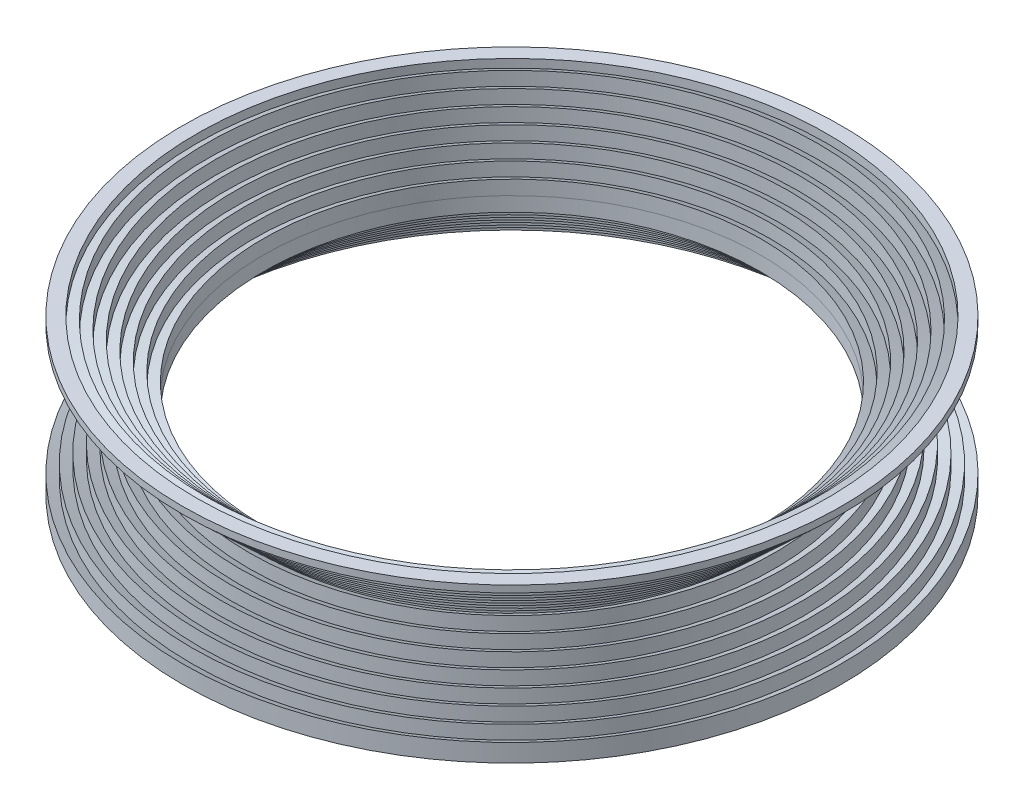
from build123d import *

# Parameters (mm, degrees)
SKETCH_1_R      = 35.893803705
EXTRUDE_1_DEPTH = 1.2


# Read off the part's stored shape, not the designer's step: 쉘1
with BuildPart() as part:
    # 스케치1 → 보스-돌출1 (new body)
    with BuildSketch(Plane(origin=(0, 0, 0), x_dir=(1, 0, 0), z_dir=(0, 1, 0))):
        with Locations(Location((0, 0, 0), (0, 0, 270))):
            Circle(SKETCH_1_R)
    extrude(amount=EXTRUDE_1_DEPTH)

    # 스케치4 → 회전1 (revolve)
    with BuildSketch(Plane(origin=(0, 0, 0), x_dir=(0, 0, -1), z_dir=(1, 0, 0))):
        Polygon((-27.588745887, 9), (0, 9), (0, 1.2), (-35.893803705, 1.2), (-35.893803705, 1.95), (-34.855087797, 1.425548185), (-34.855087797, 2.925548185), (-33.816371888, 2.401096371), (-33.816371888, 3.901096371), (-32.77765598, 3.376644556), (-32.77765598, 4.876644556), (-31.738940072, 4.352192742), (-31.738940072, 5.852192742), (-30.700224164, 5.327740927), (-30.700224164, 6.827740927), (-29.661508256, 6.303289112), (-29.661508256, 7.803289112), (-28.622792347, 7.278837298), (-28.622792347, 8.778837298), (-27.584076439, 8.254385483), align=None)
    revolve_1 = revolve(axis=Axis((0, 9, 0), (0, -1, 0)))

    # 대칭 복사1: 회전1 across plane
    add(revolve_1.mirror(Plane(origin=(0, 9, 27.588745887), x_dir=(0, 0, 1), z_dir=(0, 1, 0))))

    # 쉘1 outline → 쉘1 (revolve, cut)
    with BuildSketch(Plane.XY):
        Polygon((35.393803705, 0), (35.393803705, 1.137430146), (34.355087797, 0.612978331), (34.355087797, 2.112978331), (33.316371888, 1.588526517), (33.316371888, 3.088526517), (32.27765598, 2.564074702), (32.27765598, 4.064074702), (31.238940072, 3.539622887), (31.238940072, 5.039622887), (30.200224164, 4.515171073), (30.200224164, 6.015171073), (29.161508256, 5.490719258), (29.161508256, 6.990719258), (28.122792347, 6.466267444), (28.122792347, 7.966267444), (27.078961703, 7.439233178), (27.088736082, 9), (27.078961703, 10.560766822), (28.122792347, 10.033732556), (28.122792347, 11.533732556), (29.161508256, 11.009280742), (29.161508256, 12.509280742), (30.200224164, 11.984828927), (30.200224164, 13.484828927), (31.238940072, 12.960377113), (31.238940072, 14.460377113), (32.27765598, 13.935925298), (32.27765598, 15.435925298), (33.316371888, 14.911473483), (33.316371888, 16.411473483), (34.355087797, 15.887021669), (34.355087797, 16.8), (0, 16.8), (0, 0), align=None)
    revolve(axis=Axis((0, 0, 0), (0, 1, 0)), mode=Mode.SUBTRACT)


solid = part.part
